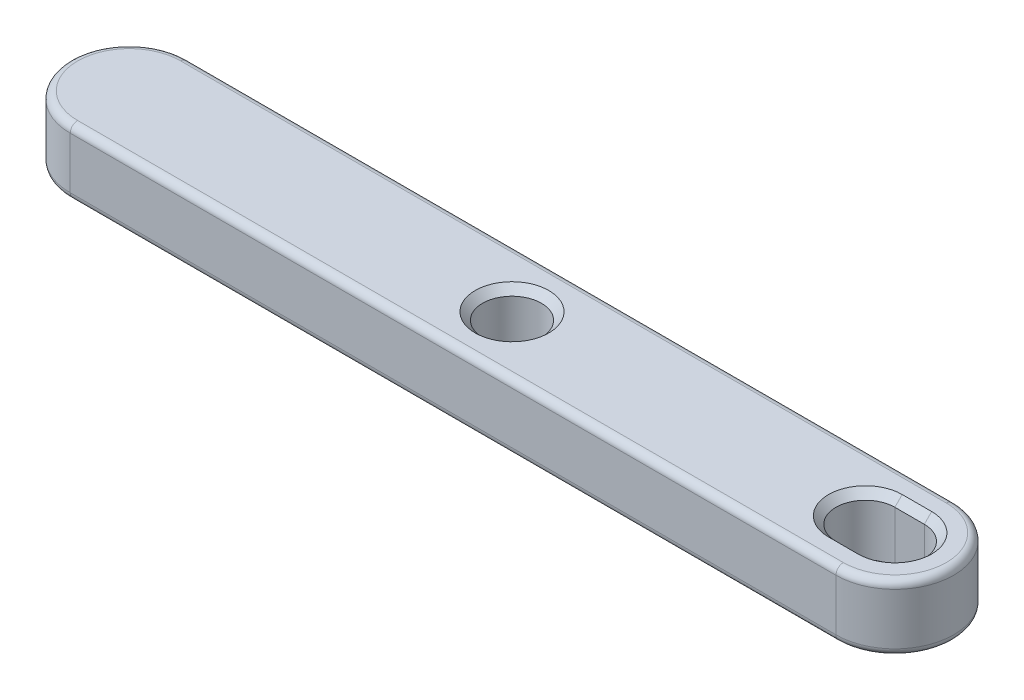
from build123d import *

# Parameters (mm, degrees)
ESBO_O1_R                = 2
RESSALTO_EXTRUS_O1_DEPTH = 2.25
CHANFRO1_SIZE            = 0.5
FILETE1_R                = 0.5


with BuildPart() as part:
    # Esboço1 → Ressalto-extrusão1 (new, symmetric)
    with BuildSketch(Plane(origin=(0, 0, 0), x_dir=(1, 0, 0), z_dir=(0, 1, 0))):
        with BuildLine():
            Line((-26, 4), (26, 4))
            ThreePointArc((26, 4), (30, 0), (26, -4))
            Line((26, -4), (-26, -4))
            ThreePointArc((-26, -4), (-30, 0), (-26, 4))
        make_face()
        Circle(ESBO_O1_R, mode=Mode.SUBTRACT)
        with BuildLine():
            Line((26, -2), (24, -2))
            ThreePointArc((24, -2), (22, 0), (24, 2))
            Line((24, 2), (26, 2))
            ThreePointArc((26, 2), (28, 0), (26, -2))
        make_face(mode=Mode.SUBTRACT)
    extrude(amount=RESSALTO_EXTRUS_O1_DEPTH, both=True)

    # Chanfro1
    chanfro1_edges = [part.edges().sort_by_distance(p)[0] for p in [
        (28, -2.25, 0),
        (25, -2.25, -2),
        (25, -2.25, 2),
        (22, -2.25, 0),
        (-2, -2.25, 0),
        (25, 2.25, 2),
        (28, 2.25, 0),
        (22, 2.25, 0),
        (25, 2.25, -2),
        (-2, 2.25, 0),
    ]]
    chamfer(chanfro1_edges, length=CHANFRO1_SIZE)

    # Filete1
    filete1_edges = [part.edges().sort_by_distance(p)[0] for p in [
        (-30, 2.25, 0),
        (0, 2.25, -4),
        (30, 2.25, 0),
        (-30, -2.25, 0),
        (0, -2.25, -4),
        (30, -2.25, 0),
        (0, 2.25, 4),
        (0, -2.25, 4),
    ]]
    fillet(filete1_edges, radius=FILETE1_R)


solid = part.part
